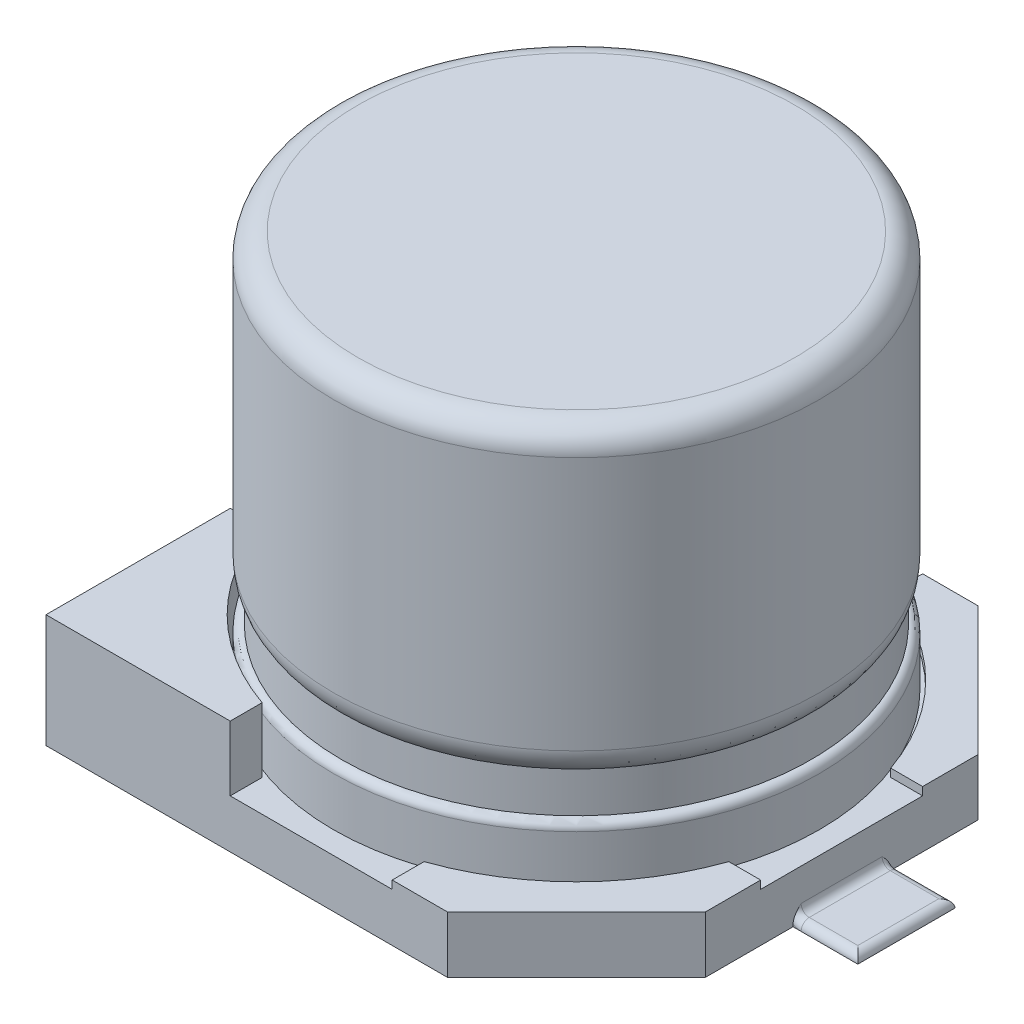
from build123d import *

# Parameters (mm, degrees)
BOSS_EXTRU_1_DEPTH      = 0.7
ENL_V_MAT_EXTRU_1_DEPTH = 0.1
BOSS_EXTRU_2_START      = 0.7
BOSS_EXTRU_2_DEPTH      = 0.7
ESQUISSE4_R             = 3
BOSS_EXTRU_3_DEPTH      = 0.7
CONG_1_R                = 0.1
ESQUISSE5_R             = 2.9
BOSS_EXTRU_4_DEPTH      = 0.5
ESQUISSE6_R             = 3
BOSS_EXTRU_5_DEPTH      = 3.7
CONG_2_R                = 0.4
CONG_3_R                = 0.3
ESQUISSE7_W             = 1.2
ESQUISSE7_H             = 0.1
BOSS_EXTRU_6_DEPTH      = 0.8
CONG_4_R                = 0.1
CONG_5_R                = 0.1
ESQUISSE8_W             = 1.2
ESQUISSE8_H             = 0.1
BOSS_EXTRU_7_DEPTH      = 0.8
CONG_6_R                = 0.1
CONG_7_R                = 0.1


with BuildPart() as part:
    # Esquisse1 → Boss.-Extru.1 (new body)
    with BuildSketch(Plane(origin=(0, 0, 0), x_dir=(1, 0, 0), z_dir=(0, 1, 0))):
        Polygon((4.959009742, 6.55), (6.55, 4.959009742), (6.55, 1.590990258), (4.959009742, 0), (0, 0), (0, 6.55), align=None)
    extrude(amount=BOSS_EXTRU_1_DEPTH)

    # Esquisse2 → Enlèv. mat.-Extru.1 (cut)
    with BuildSketch(Plane(origin=(0, 0.7, 0), x_dir=(1, 0, 0), z_dir=(0, 1, 0))):
        with BuildLine():
            Line((2.275, 6.55), (4.275, 6.55))
            Line((4.275, 6.55), (4.275, 6.156405907))
            ThreePointArc((4.275, 6.156405907), (5.431675683, 5.431675683), (6.156405907, 4.275))
            Line((6.156405907, 4.275), (6.55, 4.275))
            Line((6.55, 4.275), (6.55, 2.275))
            Line((6.55, 2.275), (6.156405907, 2.275))
            ThreePointArc((6.156405907, 2.275), (5.431675683, 1.118324317), (4.275, 0.393594093))
            Line((4.275, 0.393594093), (4.275, 0))
            Line((4.275, 0), (2.275, 0))
            Line((2.275, 0), (2.275, 0.393594093))
            ThreePointArc((2.275, 0.393594093), (1.118324317, 1.118324317), (0.393594093, 2.275))
            Line((0.393594093, 2.275), (0, 2.275))
            Line((0, 2.275), (0, 4.275))
            Line((0, 4.275), (0.393594093, 4.275))
            ThreePointArc((0.393594093, 4.275), (1.118324317, 5.431675683), (2.275, 6.156405907))
            Line((2.275, 6.156405907), (2.275, 6.55))
        make_face()
    extrude(amount=-ENL_V_MAT_EXTRU_1_DEPTH, mode=Mode.SUBTRACT)

    # Esquisse3 → Boss.-Extru.2 (add)
    with BuildSketch(Plane(origin=(0, 0.7, 0), x_dir=(1, 0, 0), z_dir=(0, 1, 0)).offset(BOSS_EXTRU_2_START)):
        with BuildLine():
            Line((0, 0), (2.275, 0))
            Line((2.275, 0), (2.275, 0.393594093))
            ThreePointArc((2.275, 0.393594093), (1.118324317, 1.118324317), (0.393594093, 2.275))
            Line((0.393594093, 2.275), (0, 2.275))
            Line((0, 2.275), (0, 0))
        make_face()
        with BuildLine():
            Line((0, 6.55), (0, 4.275))
            Line((0, 4.275), (0.393594093, 4.275))
            ThreePointArc((0.393594093, 4.275), (1.118324317, 5.431675683), (2.275, 6.156405907))
            Line((2.275, 6.156405907), (2.275, 6.55))
            Line((2.275, 6.55), (0, 6.55))
        make_face()
    extrude(amount=-BOSS_EXTRU_2_DEPTH)

    # Esquisse4 → Boss.-Extru.3 (add)
    with BuildSketch(Plane(origin=(0, 0.6, 0), x_dir=(1, 0, 0), z_dir=(0, 1, 0))):
        with Locations(Location((3.275, 3.275, 0), (0, 0, 270))):
            Circle(ESQUISSE4_R)
    extrude(amount=BOSS_EXTRU_3_DEPTH)

    # Congé1
    cong_1_edges = [part.edges().sort_by_distance(p)[0] for p in [
        (3.275, 1.3, -6.275),
    ]]
    fillet(cong_1_edges, radius=CONG_1_R)

    # Esquisse5 → Boss.-Extru.4 (add)
    with BuildSketch(Plane(origin=(0, 1.3, 0), x_dir=(1, 0, 0), z_dir=(0, 1, 0))):
        with Locations(Location((3.275, 3.275, 0), (0, 0, 270))):
            Circle(ESQUISSE5_R)
    extrude(amount=BOSS_EXTRU_4_DEPTH)

    # Esquisse6 → Boss.-Extru.5 (add)
    with BuildSketch(Plane(origin=(0, 1.8, 0), x_dir=(1, 0, 0), z_dir=(0, 1, 0))):
        with Locations(Location((3.275, 3.275, 0), (0, 0, 270))):
            Circle(ESQUISSE6_R)
    extrude(amount=BOSS_EXTRU_5_DEPTH)

    # Congé2
    # the kernel refuses this fillet: 0.4 mm, written as the material it takes off along each edge
    with BuildSketch(Plane(origin=(3.275, 1.8, -3.275), x_dir=(0, 0, 1), z_dir=(-1, 0, 0))) as cong_2_piece_1:
        with BuildLine():
            CenterArc((2.6, 0.264575131), CONG_2_R, 318.590377891, 41.409622109)
            Line((2.9, 0), (2.906, -0.005291503))
            ThreePointArc((2.906, -0.005291503), (2.95, -0.008), (3, -0.008))
            Line((3, -0.008), (3.008, 0))
            Line((3.008, 0), (3.008, 0.264575131))
            Line((3.008, 0.264575131), (3, 0.264575131))
        make_face()
    revolve(axis=Axis((3.275, 1.8, -3.275), (0, 1, 0)), mode=Mode.SUBTRACT)

    # Congé3
    cong_3_edges = [part.edges().sort_by_distance(p)[0] for p in [
        (3.275, 5.5, -6.275),
    ]]
    fillet(cong_3_edges, radius=CONG_3_R)

    # Esquisse7 → Boss.-Extru.6 (add)
    with BuildSketch(Plane(origin=(6.55, 0, 0), x_dir=(0, 0, -1), z_dir=(1, 0, 0))):
        with Locations((3.275, 0.05)):
            Rectangle(ESQUISSE7_W, ESQUISSE7_H)
    extrude(amount=BOSS_EXTRU_6_DEPTH)

    # Congé4
    cong_4_edges = [part.edges().sort_by_distance(p)[0] for p in [
        (6.55, 0.1, -3.275),
    ]]
    fillet(cong_4_edges, radius=CONG_4_R)

    # Congé5
    # the kernel refuses this fillet: 0.1 mm, written as the material it takes off along each edge
    with BuildSketch(Plane(origin=(6.65, 0.2, -3.875), x_dir=(0.8017442392976484, 0.5976672776328275, 0), z_dir=(0.5976672776328275, -0.8017442392976484, 0))) as cong_5_piece_1_section:
        with BuildLine():
            CenterArc((0.1 + CONG_5_R, CONG_5_R), CONG_5_R, 180, 90)
            Line((0.1 + CONG_5_R, 0), (0.1, 0))
            Line((0.1, 0), (0.1, CONG_5_R))
        make_face()
    cong_5_piece_1 = revolve(axis=Axis((6.65, 0.2, -3.875), (0, 0, 1)), revolution_arc=233.296989237, mode=Mode.PRIVATE)
    cong_5_piece_1 = split(cong_5_piece_1, bisect_by=Plane(origin=(6.55, 0.125006103, -3.843837174), z_dir=(1, 0, 0)), keep=Keep.TOP, mode=Mode.PRIVATE)
    add(cong_5_piece_1, mode=Mode.SUBTRACT)
    with BuildSketch(Plane(origin=(6.65, 0.2, -2.675), x_dir=(0.8017442392976484, 0.5976672776328275, 0), z_dir=(0.5976672776328275, -0.8017442392976484, 0))) as cong_5_piece_2_section:
        with BuildLine():
            CenterArc((0.1 + CONG_5_R, -CONG_5_R), CONG_5_R, 90, 90)
            Line((0.1 + CONG_5_R, 0), (0.1, 0))
            Line((0.1, 0), (0.1, -CONG_5_R))
        make_face()
    cong_5_piece_2 = revolve(axis=Axis((6.65, 0.2, -2.675), (0, 0, 1)), revolution_arc=233.296989237, mode=Mode.PRIVATE)
    cong_5_piece_2 = split(cong_5_piece_2, bisect_by=Plane(origin=(6.55, 0.125006105, -2.706162828), z_dir=(1, 0, 0)), keep=Keep.TOP, mode=Mode.PRIVATE)
    add(cong_5_piece_2, mode=Mode.SUBTRACT)
    with BuildSketch(Plane(origin=(7.35, 0.1, -4.125), x_dir=(-1, 0, 0), z_dir=(0, 0, 1))) as cong_5_piece_3:
        with BuildLine():
            CenterArc((CONG_5_R, CONG_5_R), CONG_5_R, 180, 90)
            Line((0, CONG_5_R), (0, 0))
            Line((0, 0), (CONG_5_R, 0))
        make_face()
    extrude(amount=1.7, mode=Mode.SUBTRACT)
    with BuildSketch(Plane(origin=(6.65, 0.1, -3.875), x_dir=(0, 0, 1), z_dir=(1, 0, 0))) as cong_5_piece_4:
        with BuildLine():
            CenterArc((CONG_5_R, CONG_5_R), CONG_5_R, 180, 90)
            Line((0, CONG_5_R), (0, 0))
            Line((0, 0), (CONG_5_R, 0))
        make_face()
    extrude(amount=0.95, mode=Mode.SUBTRACT)
    with BuildSketch(Plane(origin=(6.65, 0.1, -2.675), x_dir=(0, 0, -1), z_dir=(1, 0, 0))) as cong_5_piece_5:
        with BuildLine():
            CenterArc((CONG_5_R, -CONG_5_R), CONG_5_R, 90, 90)
            Line((0, -CONG_5_R), (0, 0))
            Line((0, 0), (CONG_5_R, 0))
        make_face()
    extrude(amount=0.95, mode=Mode.SUBTRACT)

    # Esquisse8 → Boss.-Extru.7 (add)
    with BuildSketch(Plane.ZY):
        with Locations((-3.275, 0.05)):
            Rectangle(ESQUISSE8_W, ESQUISSE8_H)
    extrude(amount=BOSS_EXTRU_7_DEPTH)

    # Congé6
    cong_6_edges = [part.edges().sort_by_distance(p)[0] for p in [
        (0, 0.1, -3.275),
    ]]
    fillet(cong_6_edges, radius=CONG_6_R)

    # Congé7
    # the kernel refuses this fillet: 0.1 mm, written as the material it takes off along each edge
    with BuildSketch(Plane(origin=(-0.1, 0.2, -2.675), x_dir=(-0.8017442392976492, 0.5976672776328262, 0), z_dir=(-0.5976672776328262, -0.8017442392976492, 0))) as cong_7_piece_1_section:
        with BuildLine():
            CenterArc((0.1 + CONG_7_R, CONG_7_R), CONG_7_R, 180, 90)
            Line((0.1, CONG_7_R), (0.1, 0))
            Line((0.1, 0), (0.1 + CONG_7_R, 0))
        make_face()
    cong_7_piece_1 = revolve(axis=Axis((-0.1, 0.2, -2.675), (0, 0, -1)), revolution_arc=233.296989237, mode=Mode.PRIVATE)
    cong_7_piece_1 = split(cong_7_piece_1, bisect_by=Plane(origin=(0, 0.125006101, -2.706162827), z_dir=(-1, 0, 0)), keep=Keep.TOP, mode=Mode.PRIVATE)
    add(cong_7_piece_1, mode=Mode.SUBTRACT)
    with BuildSketch(Plane(origin=(-0.1, 0.2, -3.875), x_dir=(-0.801744239297649, 0.5976672776328265, 0), z_dir=(-0.5976672776328265, -0.801744239297649, 0))) as cong_7_piece_2_section:
        with BuildLine():
            CenterArc((0.1 + CONG_7_R, -CONG_7_R), CONG_7_R, 90, 90)
            Line((0.1 + CONG_7_R, 0), (0.1, 0))
            Line((0.1, 0), (0.1, -CONG_7_R))
        make_face()
    cong_7_piece_2 = revolve(axis=Axis((-0.1, 0.2, -3.875), (0, 0, -1)), revolution_arc=233.296989237, mode=Mode.PRIVATE)
    cong_7_piece_2 = split(cong_7_piece_2, bisect_by=Plane(origin=(0, 0.125006106, -3.843837173), z_dir=(-1, 0, 0)), keep=Keep.TOP, mode=Mode.PRIVATE)
    add(cong_7_piece_2, mode=Mode.SUBTRACT)
    with BuildSketch(Plane(origin=(-0.1, 0.1, -2.675), x_dir=(0, 0, -1), z_dir=(-1, 0, 0))) as cong_7_piece_3:
        with BuildLine():
            CenterArc((CONG_7_R, CONG_7_R), CONG_7_R, 180, 90)
            Line((0, CONG_7_R), (0, 0))
            Line((0, 0), (CONG_7_R, 0))
        make_face()
    extrude(amount=0.95, mode=Mode.SUBTRACT)
    with BuildSketch(Plane(origin=(-0.8, 0.1, -4.125), x_dir=(0, -1, 0), z_dir=(0, 0, 1))) as cong_7_piece_4:
        with BuildLine():
            CenterArc((CONG_7_R, CONG_7_R), CONG_7_R, 180, 90)
            Line((0, CONG_7_R), (0, 0))
            Line((0, 0), (CONG_7_R, 0))
        make_face()
    extrude(amount=1.7, mode=Mode.SUBTRACT)
    with BuildSketch(Plane(origin=(-0.1, 0.1, -3.875), x_dir=(0, 0, 1), z_dir=(-1, 0, 0))) as cong_7_piece_5:
        with BuildLine():
            CenterArc((CONG_7_R, -CONG_7_R), CONG_7_R, 90, 90)
            Line((0, -CONG_7_R), (0, 0))
            Line((0, 0), (CONG_7_R, 0))
        make_face()
    extrude(amount=0.95, mode=Mode.SUBTRACT)


solid = part.part
